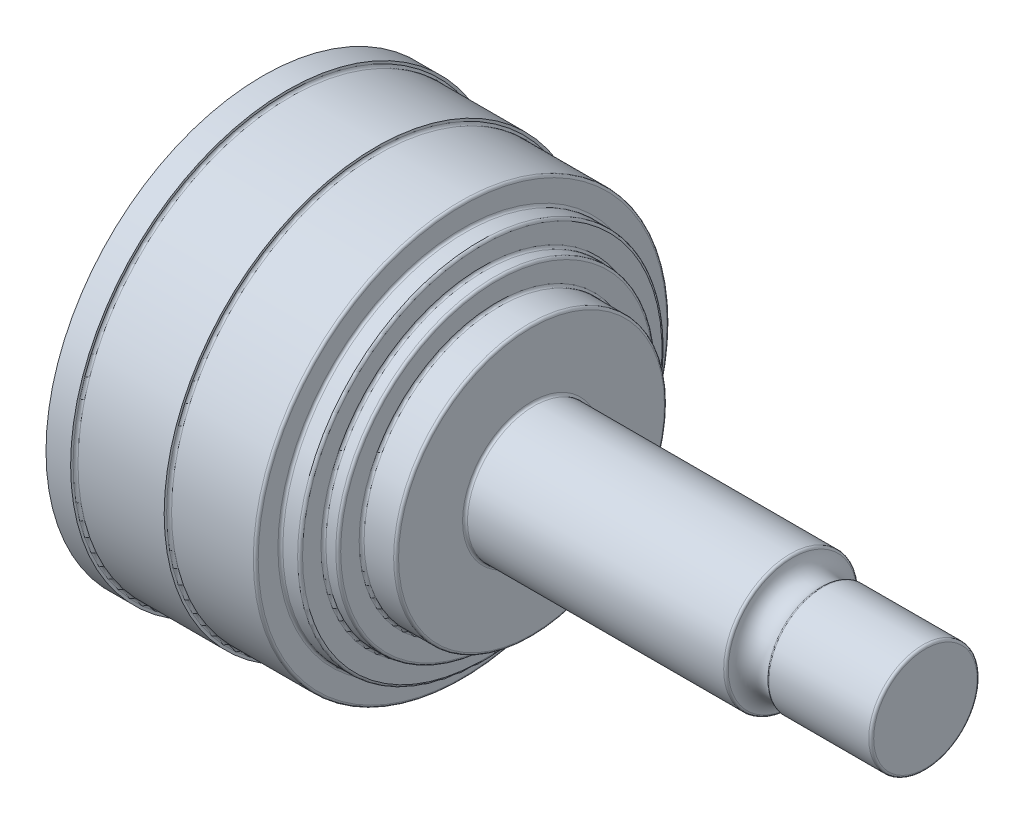
from build123d import *

# Parameters (mm, degrees)
FILLET1_R = 0.5


with BuildPart() as part:
    # Sketch1 → Revolve1 (revolve)
    with BuildSketch(Plane.XY):
        with BuildLine():
            Line((134.6, 0), (134.6, 11))
            Line((134.6, 11), (113.6, 11))
            ThreePointArc((113.6, 11), (109.766666667, 10.25), (107.6, 13.5))
            Line((107.6, 13.5), (54.6, 13.5))
            Line((54.6, 13.5), (54.6, 27.5))
            Line((54.6, 27.5), (47.6, 27.5))
            Line((47.6, 27.5), (47.6, 32.25))
            Line((47.6, 32.25), (44.6, 32.25))
            Line((44.6, 32.25), (44.6, 37))
            Line((44.6, 37), (40.6, 37))
            Line((40.6, 37), (40.6, 42))
            Line((40.6, 42), (23, 42))
            Line((23, 42), (23, 43))
            Line((23, 43), (5, 43))
            Line((5, 43), (5, 44))
            Line((5, 44), (0, 44))
            Line((0, 44), (0, 0))
            Line((0, 0), (134.6, 0))
        make_face()
    revolve(axis=Axis((-159.727345132, 0, 0), (1, 0, 0)))

    # Fillet1
    fillet1_edges = [part.edges().sort_by_distance(p)[0] for p in [
        (134.6, -11, 0),
        (113.6, -11, 0),
        (107.6, -13.5, 0),
        (54.6, -13.5, 0),
        (54.6, -27.5, 0),
        (47.6, -27.5, 0),
        (47.6, -32.25, 0),
        (44.6, -32.25, 0),
        (44.6, -37, 0),
        (40.6, -37, 0),
        (40.6, -42, 0),
        (23, -42, 0),
        (5, -43, 0),
    ]]
    fillet(fillet1_edges, radius=FILLET1_R)


solid = part.part
